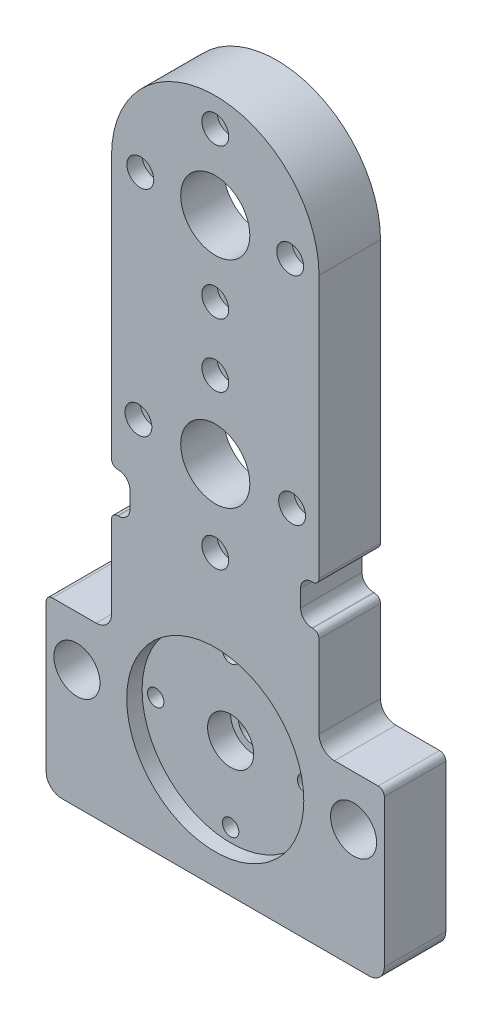
from build123d import *

# Parameters (mm, degrees)
BOLT_CIRCLE_R                                     = 14.2748
BOLT_CIRCLE_R_2                                   = 6.35
BASE_DEPTH                                        = 12.7
STRUCTURE_TUBE_CONNECTION_COUNTERBORE_D           = 6.7564
STRUCTURE_TUBE_CONNECTION_COUNTERBORE_CBORE_D     = 11.1125
STRUCTURE_TUBE_CONNECTION_COUNTERBORE_CBORE_DEPTH = 6.35
STRUCTURE_TUBE_CONNECTION_COUNTERBORE_PA_COUNT    = 4
SPINDLE_CONNECTION_COUNTERBORE_D                  = 6.7564
SPINDLE_CONNECTION_COUNTERBORE_CBORE_D            = 11.1125
SPINDLE_CONNECTION_COUNTERBORE_CBORE_DEPTH        = 6.35
SPINDLE_CONNECTION_COUNTERBORE_PATTERN_COUNT      = 4
SKETCH16_R                                        = 36.576
STRUCTURE_TUBE_MOUNTING_POCKET_DEPTH              = 6.35
SKETCH17_R                                        = 36.576
SPINDLE_MOUNTING_POCKET_DEPTH                     = 7.62
SKETCH18_R                                        = 9.525
LEAD_SCREW_THROUGH_HOLE_DEPTH                     = 9.525
SKETCH20_R                                        = 9.525
RAIL_MOUNTING_PILOT_HOLES_DEPTH                   = 169.702482958
GENERIC_ROUNDING_FILLET_R                         = 6.35
WOOD_SPINDLE_CBORE_D                              = 6.7564
WOOD_SPINDLE_CBORE_CBORE_D                        = 11.1125
WOOD_SPINDLE_CBORE_CBORE_DEPTH                    = 6.35
CIRPATTERN1_COUNT                                 = 4
SKETCH30_R                                        = 36.576
WOOD_SPINDLE_MOUNTING_POCKET_DEPTH                = 7.62
CROSS_SLIDE_FILLETS_R                             = 4.7625
FILLET2_R                                         = 2.54


with BuildPart() as part:
    # Bolt circle → Base (new, symmetric)
    with BuildSketch(Plane.XY):
        with BuildLine():
            Line((-42.8625, 88.9), (-42.8625, -22.1615))
            Line((-42.8625, -22.1615), (-35.2425, -22.1615))
            Line((-35.2425, -22.1615), (-35.2425, -38.6715))
            Line((-35.2425, -38.6715), (-42.8625, -38.6715))
            Line((-42.8625, -38.6715), (-42.8625, -81.5975))
            Line((-42.8625, -81.5975), (-69.85, -81.5975))
            Line((-69.85, -81.5975), (-69.85, -151.4475))
            Line((-69.85, -151.4475), (69.85, -151.4475))
            Line((69.85, -151.4475), (69.85, -81.5975))
            Line((69.85, -81.5975), (42.8625, -81.5975))
            Line((42.8625, -81.5975), (42.8625, -38.6715))
            Line((42.8625, -38.6715), (35.2425, -38.6715))
            Line((35.2425, -38.6715), (35.2425, -22.1615))
            Line((35.2425, -22.1615), (42.8625, -22.1615))
            Line((42.8625, -22.1615), (42.8625, 88.9))
            ThreePointArc((42.8625, 88.9), (0, 131.7625), (-42.8625, 88.9))
        make_face()
        with Locations((0, 88.9)):
            Circle(BOLT_CIRCLE_R, mode=Mode.SUBTRACT)
        Circle(BOLT_CIRCLE_R, mode=Mode.SUBTRACT)
        with Locations((0, -102.235)):
            Circle(BOLT_CIRCLE_R_2, mode=Mode.SUBTRACT)
    extrude(amount=BASE_DEPTH, both=True)

    # Structure tube connection counterbore (through all)
    with Locations(Plane(origin=(0, 0, -12.7), x_dir=(-1, 0, 0), z_dir=(0, 0, -1))):
        with Locations((0, -71.27875)):
            structure_tube_connection_counterbore = CounterBoreHole(STRUCTURE_TUBE_CONNECTION_COUNTERBORE_D / 2, STRUCTURE_TUBE_CONNECTION_COUNTERBORE_CBORE_D / 2, STRUCTURE_TUBE_CONNECTION_COUNTERBORE_CBORE_DEPTH)

    # Structure tube connection counterbore pattern: Structure tube connection counterbore ×4 about axis
    structure_tube_connection_counterbore_pa_axis = Axis((0, -102.235, 12.7), (0, 0, -1))
    for i in range(1, STRUCTURE_TUBE_CONNECTION_COUNTERBORE_PA_COUNT):
        add(structure_tube_connection_counterbore.rotate(structure_tube_connection_counterbore_pa_axis, i * 360 / STRUCTURE_TUBE_CONNECTION_COUNTERBORE_PA_COUNT), mode=Mode.SUBTRACT)

    # Spindle connection counterbore (through all)
    with Locations(Plane.XY.offset(12.7)):
        with Locations((0, 31.75)):
            spindle_connection_counterbore = CounterBoreHole(SPINDLE_CONNECTION_COUNTERBORE_D / 2, SPINDLE_CONNECTION_COUNTERBORE_CBORE_D / 2, SPINDLE_CONNECTION_COUNTERBORE_CBORE_DEPTH)

    # Spindle connection counterbore pattern: Spindle connection counterbore ×4 about axis
    spindle_connection_counterbore_pattern_axis = Axis((0, 0, 12.7), (0, 0, -1))
    for i in range(1, SPINDLE_CONNECTION_COUNTERBORE_PATTERN_COUNT):
        add(spindle_connection_counterbore.rotate(spindle_connection_counterbore_pattern_axis, i * 360 / SPINDLE_CONNECTION_COUNTERBORE_PATTERN_COUNT), mode=Mode.SUBTRACT)

    # Sketch16 → Structure tube mounting pocket (cut)
    with BuildSketch(Plane.XY.offset(12.7)):
        with Locations((0, -102.235)):
            Circle(SKETCH16_R)
    extrude(amount=-STRUCTURE_TUBE_MOUNTING_POCKET_DEPTH, mode=Mode.SUBTRACT)

    # Sketch17 → Spindle mounting pocket (cut)
    with BuildSketch(Plane(origin=(0, 0, -12.7), x_dir=(-1, 0, 0), z_dir=(0, 0, -1))):
        Circle(SKETCH17_R)
    extrude(amount=-SPINDLE_MOUNTING_POCKET_DEPTH, mode=Mode.SUBTRACT)

    # Sketch18 → Lead screw through hole (cut)
    with BuildSketch(Plane.XY.offset(6.35)):
        with Locations((0, -102.235)):
            Circle(SKETCH18_R)
    extrude(amount=-LEAD_SCREW_THROUGH_HOLE_DEPTH, mode=Mode.SUBTRACT)

    # Sketch20 → Rail mounting pilot_holes (cut, through all)
    with BuildSketch(Plane.XY.offset(12.7)):
        with Locations((57.15, -102.235)):
            Circle(SKETCH20_R)
        with Locations((-57.15, -102.235)):
            Circle(SKETCH20_R)
    extrude(amount=-RAIL_MOUNTING_PILOT_HOLES_DEPTH, mode=Mode.SUBTRACT)

    # Generic_rounding_fillet
    generic_rounding_fillet_edges = [part.edges().sort_by_distance(p)[0] for p in [
        (-69.85, -151.4475, 0),
        (69.85, -151.4475, 0),
        (-42.8625, -81.5975, 0),
        (42.8625, -81.5975, 0),
    ]]
    fillet(generic_rounding_fillet_edges, radius=GENERIC_ROUNDING_FILLET_R)

    # wood_spindle_CBORE (through all)
    with Locations(Plane.XY.offset(12.7)):
        with Locations((0, 119.85625)):
            wood_spindle_cbore = CounterBoreHole(WOOD_SPINDLE_CBORE_D / 2, WOOD_SPINDLE_CBORE_CBORE_D / 2, WOOD_SPINDLE_CBORE_CBORE_DEPTH)

    # CirPattern1: wood_spindle_CBORE ×4 about axis
    cirpattern1_axis = Axis((0, 88.9, 12.7), (0, 0, -1))
    for i in range(1, CIRPATTERN1_COUNT):
        add(wood_spindle_cbore.rotate(cirpattern1_axis, i * 360 / CIRPATTERN1_COUNT), mode=Mode.SUBTRACT)

    # Sketch30 → wood_spindle_mounting_pocket (cut)
    with BuildSketch(Plane(origin=(0, 0, -12.7), x_dir=(-1, 0, 0), z_dir=(0, 0, -1))):
        with Locations((0, 88.9)):
            Circle(SKETCH30_R)
    extrude(amount=-WOOD_SPINDLE_MOUNTING_POCKET_DEPTH, mode=Mode.SUBTRACT)

    # cross_slide_fillets
    cross_slide_fillets_edges = [part.edges().sort_by_distance(p)[0] for p in [
        (-35.2425, -38.6715, 0),
        (-35.2425, -22.1615, 0),
        (35.2425, -38.6715, 0),
        (35.2425, -22.1615, 0),
    ]]
    fillet(cross_slide_fillets_edges, radius=CROSS_SLIDE_FILLETS_R)

    # Fillet2
    fillet2_edges = [part.edges().sort_by_distance(p)[0] for p in [
        (-42.8625, -22.1615, 0),
        (42.8625, -22.1615, 0),
        (42.8625, -38.6715, 0),
        (-42.8625, -38.6715, 0),
        (69.85, -81.5975, 0),
        (-69.85, -81.5975, 0),
    ]]
    fillet(fillet2_edges, radius=FILLET2_R)


solid = part.part
